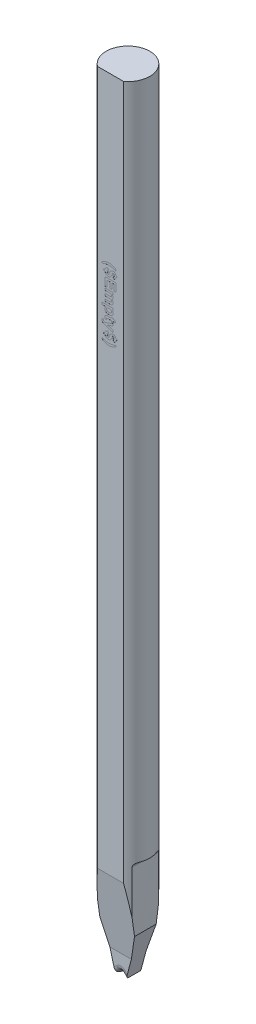
from build123d import *

# Parameters (mm, degrees)
SKETCH_TL_CUTTING_R       = 1.99771
TL_CUTTING_DEPTH          = 72.009
SKETCH_TDF_GRINDING_W     = 4.01542
SKETCH_TDF_GRINDING_H     = 4.01542
TDF_GRINDING_DEPTH        = 73.064400167
ENGRAVING_DEPTH           = 0.005
VW_VR_GRINDING_DEPTH      = 2.00771
VW_VR_GRINDING_DEPTH_BACK = 2.00771
ISA_GRINDING_DEPTH        = 2.00771
ISA_GRINDING_DEPTH_BACK   = 2.00771
PRE_FRX_BRX_DEPTH         = 2.00771
PRE_FRX_BRX_DEPTH_BACK    = 2.00771
SKETCH_PRE_FRX_BRX_W      = 1.33334
SKETCH_PRE_FRX_BRX_H      = 1.80086
FR_EDM_R                  = 0.50038
BR_EDM_R                  = 0.24892
FA_BA_GRINDING_DEPTH      = 2.00771
FA_BA_GRINDING_DEPTH_BACK = 2.00771


with BuildPart() as part:
    # sketch_TL_cutting → TL_cutting (new body)
    with BuildSketch(Plane(origin=(0, 0, 0), x_dir=(1, 0, 0), z_dir=(0, 1, 0))):
        Circle(SKETCH_TL_CUTTING_R)
    extrude(amount=TL_CUTTING_DEPTH)

    # sketch_TDF_grinding → TDF_grinding (cut, through all)
    with BuildSketch(Plane(origin=(0, 0, 0), x_dir=(1, 0, 0), z_dir=(0, 1, 0))):
        with Locations((0, -3.60918)):
            Rectangle(SKETCH_TDF_GRINDING_W, SKETCH_TDF_GRINDING_H)
    extrude(amount=TDF_GRINDING_DEPTH, mode=Mode.SUBTRACT)

    # sketch_engraving → engraving (cut)
    # profile 1 of 9: a face of its own
    with BuildSketch(Plane.XY.offset(1.60147)):
        with BuildLine():
            Line((-0.769230769, 56.611564103), (-0.769230769, 56.726948718))
            add(Edge.make_bspline(
                [(-0.769230769, 56.726948718), (-0.75654381, 56.735663826), (-0.731271202, 56.75302445), (-0.692407522, 56.777108744), (-0.653253405, 56.799807931), (-0.61390654, 56.821057444), (-0.574088198, 56.840594152), (-0.533834647, 56.85827299), (-0.493399806, 56.874882514), (-0.452559629, 56.889379278), (-0.411730957, 56.902372472), (-0.37117072, 56.913933672), (-0.330720232, 56.923167297), (-0.290776237, 56.931412038), (-0.251027852, 56.937272807), (-0.211754164, 56.941765375), (-0.172781576, 56.944468765), (-0.146905785, 56.944754889), (-0.134014423, 56.944897436)],
                knots=[0, 0, 0, 0, 1.083507766, 2.158363427, 3.217863588, 4.26952313, 5.306027247, 6.339424422, 7.364296331, 8.382863073, 9.389381803, 10.380601174, 11.351000725, 12.30983044, 13.25126181, 14.178453692, 15.092502614, 16, 16, 16, 16], degree=3))
            add(Edge.make_bspline(
                [(-0.134014423, 56.944897436), (-0.118183889, 56.944720886), (-0.086756823, 56.944370396), (-0.039956705, 56.941072127), (0.006211299, 56.935593151), (0.051774559, 56.928331702), (0.096653064, 56.918551161), (0.140935004, 56.90698945), (0.184649405, 56.893283306), (0.2131297, 56.882285182), (0.227363782, 56.876788462)],
                knots=[0, 0, 0, 0, 1.026825403, 2.038472649, 3.041589395, 4.042121555, 5.030199178, 6.019908545, 7.010375948, 8, 8, 8, 8], degree=3))
            add(Edge.make_bspline(
                [(0.227363782, 56.876788462), (0.251683724, 56.86662748), (0.300012726, 56.846435406), (0.369571494, 56.810574678), (0.43660795, 56.771337941), (0.478889333, 56.74173111), (0.5, 56.726948718)],
                knots=[0, 0, 0, 0, 1.013799707, 2.014640032, 3.00872983, 4, 4, 4, 4], degree=3))
            Line((0.5, 56.726948718), (0.5, 56.611564103))
            add(Edge.make_bspline(
                [(0.5, 56.611564103), (0.483671183, 56.618120598), (0.451734259, 56.630944202), (0.404403907, 56.648404634), (0.359131946, 56.664765299), (0.315658143, 56.679413628), (0.273946214, 56.69238068), (0.234213299, 56.70413527), (0.196217088, 56.713881677), (0.148045143, 56.725244778), (0.087918925, 56.736328711), (0.014547585, 56.745586625), (-0.060927268, 56.751701265), (-0.111967077, 56.752291015), (-0.137820513, 56.752589744)],
                knots=[0, 0, 0, 0, 0.962863393, 1.883228553, 2.76049045, 3.597092273, 4.393389301, 5.150807945, 5.864262675, 6.539665604, 7.859093728, 9.207470704, 10.585486956, 12, 12, 12, 12], degree=3))
            add(Edge.make_bspline(
                [(-0.137820513, 56.752589744), (-0.155988322, 56.752343487), (-0.192554908, 56.751847842), (-0.247746387, 56.748261408), (-0.303631191, 56.742771672), (-0.359778417, 56.734616456), (-0.415599441, 56.724983778), (-0.470281715, 56.713252997), (-0.523675907, 56.700229417), (-0.558467126, 56.689835667), (-0.575721154, 56.68468109)],
                knots=[0, 0, 0, 0, 0.980476084, 1.97341699, 2.983932057, 4.010380506, 5.034783484, 6.040583597, 7.02826557, 8, 8, 8, 8], degree=3))
            add(Edge.make_bspline(
                [(-0.575721154, 56.68468109), (-0.581680072, 56.682859776), (-0.594203733, 56.679031979), (-0.613643056, 56.671976075), (-0.635084462, 56.664505083), (-0.658352199, 56.655786341), (-0.683499135, 56.646272512), (-0.710430496, 56.635536673), (-0.739235975, 56.623981317), (-0.7590223, 56.615790194), (-0.769230769, 56.611564103)],
                knots=[0, 0, 0, 0, 0.722569934, 1.518601428, 2.397973139, 3.356076064, 4.400297102, 5.516290093, 6.718565658, 8, 8, 8, 8], degree=3))
        make_face()
    # profile 2 of 9: a face of its own
    with BuildSketch(Plane.XY.offset(1.60147)):
        with BuildLine():
            Line((-0.346153846, 56.226948718), (-0.063902244, 56.226948718))
            add(Edge.make_bspline(
                [(-0.063902244, 56.226948718), (-0.060691422, 56.237143266), (-0.054417647, 56.257062868), (-0.043102981, 56.285435864), (-0.03104034, 56.311894737), (-0.017255553, 56.335922913), (-0.002706808, 56.358195401), (0.013349437, 56.378160446), (0.030392388, 56.396185381), (0.048816212, 56.411900426), (0.068263793, 56.425644345), (0.088567069, 56.437911105), (0.110125164, 56.447723618), (0.132438861, 56.456389102), (0.155973296, 56.462652823), (0.180398952, 56.467325467), (0.205875491, 56.469883399), (0.223151848, 56.470317076), (0.231971154, 56.470538462)],
                knots=[0, 0, 0, 0, 1.233471439, 2.410137288, 3.52407584, 4.58730311, 5.604983541, 6.592165279, 7.540854934, 8.464761394, 9.382375568, 10.287963167, 11.198393515, 12.113251355, 13.048281916, 14.005296989, 14.981735836, 16, 16, 16, 16], degree=3))
            add(Edge.make_bspline(
                [(0.231971154, 56.470538462), (0.240862374, 56.470369834), (0.258371063, 56.47003777), (0.284035262, 56.466710465), (0.308630388, 56.461512705), (0.332214124, 56.454327878), (0.354666156, 56.444872426), (0.375999861, 56.433410852), (0.396225213, 56.419891645), (0.415061575, 56.404246572), (0.432812136, 56.387237259), (0.448139285, 56.36818408), (0.461933462, 56.348127842), (0.473588781, 56.326562978), (0.483166571, 56.303572929), (0.491049568, 56.279359162), (0.496663149, 56.253639945), (0.49887037, 56.235984548), (0.5, 56.226948718)],
                knots=[0, 0, 0, 0, 1.065419917, 2.098036635, 3.096580821, 4.076501369, 5.04880669, 6.012240184, 6.975806694, 7.959773282, 8.944748783, 9.917449457, 10.885494533, 11.859775015, 12.849941464, 13.867618658, 14.908671599, 16, 16, 16, 16], degree=3))
            Line((0.5, 56.226948718), (0.576923077, 56.226948718))
            Line((0.576923077, 56.226948718), (0.576923077, 56.124384615))
            Line((0.576923077, 56.124384615), (0.5, 56.124384615))
            add(Edge.make_bspline(
                [(0.5, 56.124384615), (0.498841424, 56.115486686), (0.496573389, 56.09806805), (0.49137632, 56.072741064), (0.484539762, 56.048860422), (0.476339583, 56.026349842), (0.466697028, 56.005143702), (0.455518194, 55.985361964), (0.442840864, 55.966933141), (0.428527318, 55.95018479), (0.413145824, 55.934584638), (0.39610941, 55.920827789), (0.378155721, 55.908112331), (0.358829355, 55.897061433), (0.338178987, 55.887674614), (0.316411919, 55.87941047), (0.293274546, 55.872799442), (0.27733531, 55.869600771), (0.269230769, 55.867974359)],
                knots=[0, 0, 0, 0, 1.151887312, 2.254940947, 3.31604567, 4.338626222, 5.328478017, 6.30366564, 7.252607131, 8.195603958, 9.129238937, 10.061258459, 11.003163313, 11.951756149, 12.914654824, 13.913120779, 14.938895277, 16, 16, 16, 16], degree=3))
            Line((0.269230769, 55.867974359), (0.243589744, 56.034641026))
            add(Edge.make_bspline(
                [(0.243589744, 56.034641026), (0.250446456, 56.036643558), (0.263771485, 56.040535192), (0.282535036, 56.048465441), (0.299671316, 56.057678859), (0.315110354, 56.068227628), (0.328747964, 56.080224188), (0.340615646, 56.09355588), (0.351026936, 56.108191319), (0.356312409, 56.118960751), (0.358974359, 56.124384615)],
                knots=[0, 0, 0, 0, 1.132612369, 2.201068414, 3.225051706, 4.215432487, 5.161289188, 6.099220658, 7.04270083, 8, 8, 8, 8], degree=3))
            Line((0.358974359, 56.124384615), (0.095552885, 56.124384615))
            add(Edge.make_bspline(
                [(0.095552885, 56.124384615), (0.091846888, 56.111134392), (0.084711092, 56.085621445), (0.072793936, 56.049230821), (0.059721416, 56.016296736), (0.046029912, 55.986577051), (0.031359337, 55.960199095), (0.016057305, 55.936950063), (-0.000406851, 55.917264806), (-0.017692985, 55.90057685), (-0.036309981, 55.887032312), (-0.055531671, 55.874731893), (-0.076319964, 55.864821076), (-0.098285192, 55.856514134), (-0.121510852, 55.850207549), (-0.145938277, 55.845497559), (-0.171622588, 55.842996815), (-0.189164574, 55.842557523), (-0.198116987, 55.842333333)],
                knots=[0, 0, 0, 0, 1.47567488, 2.841372022, 4.104837161, 5.274356171, 6.348422789, 7.339634063, 8.254806618, 9.095728451, 9.909336987, 10.720135121, 11.540149133, 12.374211184, 13.236039526, 14.118162803, 15.039619326, 16, 16, 16, 16], degree=3))
            add(Edge.make_bspline(
                [(-0.198116987, 55.842333333), (-0.208142, 55.842575379), (-0.227850116, 55.843051216), (-0.256821167, 55.846471811), (-0.284551423, 55.852320659), (-0.311143037, 55.860302461), (-0.336478096, 55.870703856), (-0.360449465, 55.883721867), (-0.383339011, 55.898751156), (-0.405018236, 55.915957227), (-0.425053345, 55.935437905), (-0.443316442, 55.956889482), (-0.459578741, 55.980293772), (-0.474036034, 56.005432354), (-0.486703174, 56.032431862), (-0.497491454, 56.061298177), (-0.506369109, 56.092117722), (-0.510637243, 56.113464927), (-0.512820513, 56.124384615)],
                knots=[0, 0, 0, 0, 1.03830894, 2.041205585, 3.016534218, 3.970513834, 4.913295289, 5.847846025, 6.791667113, 7.746548932, 8.710133323, 9.681653264, 10.66021374, 11.657945465, 12.682082278, 13.745789509, 14.84690868, 16, 16, 16, 16], degree=3))
            Line((-0.512820513, 56.124384615), (-0.641025641, 56.124384615))
            Line((-0.641025641, 56.124384615), (-0.641025641, 56.226948718))
            Line((-0.641025641, 56.226948718), (-0.512820513, 56.226948718))
            add(Edge.make_bspline(
                [(-0.512820513, 56.226948718), (-0.511365569, 56.235993376), (-0.508497729, 56.253821301), (-0.501708114, 56.279680106), (-0.493672179, 56.304444222), (-0.483362821, 56.327734513), (-0.471282985, 56.349710338), (-0.457442831, 56.370330001), (-0.441914521, 56.389778959), (-0.424444795, 56.407782199), (-0.405185733, 56.424467381), (-0.384010208, 56.4395823), (-0.360904849, 56.452986013), (-0.335919458, 56.464741317), (-0.309230571, 56.475320078), (-0.280464835, 56.483703551), (-0.249946988, 56.491100501), (-0.228795072, 56.494457879), (-0.217948718, 56.496179487)],
                knots=[0, 0, 0, 0, 1.014565868, 1.999810643, 2.959153021, 3.896762473, 4.817401281, 5.734733625, 6.645326844, 7.571538865, 8.510548692, 9.465314575, 10.450114695, 11.466190414, 12.522838407, 13.627737783, 14.783543095, 16, 16, 16, 16], degree=3))
            Line((-0.217948718, 56.496179487), (-0.192307692, 56.329512821))
            add(Edge.make_bspline(
                [(-0.192307692, 56.329512821), (-0.201304383, 56.327560775), (-0.218871734, 56.323749123), (-0.243936875, 56.315017324), (-0.267070938, 56.304026951), (-0.287973212, 56.290797737), (-0.306574231, 56.276291657), (-0.322506138, 56.260740348), (-0.336055086, 56.244580368), (-0.342841228, 56.232732292), (-0.346153846, 56.226948718)],
                knots=[0, 0, 0, 0, 1.156277083, 2.257799727, 3.327693098, 4.368586128, 5.360870913, 6.286760294, 7.163691387, 8, 8, 8, 8], degree=3))
        make_face()
        with BuildLine():
            add(Edge.make_bspline(
                [(0.358974359, 56.226948718), (0.356717333, 56.232992086), (0.352323078, 56.244758059), (0.342207363, 56.260507034), (0.329671684, 56.273923048), (0.314627801, 56.284702628), (0.298154817, 56.293142912), (0.280699719, 56.299552483), (0.262303768, 56.303185993), (0.249748228, 56.303641235), (0.243389423, 56.303871795)],
                knots=[0, 0, 0, 0, 1.038261919, 2.021415961, 2.996868165, 3.983674221, 4.990617688, 5.975363788, 6.97461459, 8, 8, 8, 8], degree=3))
            add(Edge.make_bspline(
                [(0.243389423, 56.303871795), (0.23756032, 56.303721402), (0.225998475, 56.303423102), (0.209074665, 56.29974233), (0.192634157, 56.29441819), (0.177010257, 56.286573685), (0.16226258, 56.276278866), (0.149112783, 56.262726829), (0.137430451, 56.24612493), (0.131236645, 56.233523802), (0.128004808, 56.226948718)],
                knots=[0, 0, 0, 0, 0.946787839, 1.877924175, 2.805567745, 3.753041052, 4.711661487, 5.718097864, 6.809336945, 8, 8, 8, 8], degree=3))
            Line((0.128004808, 56.226948718), (0.358974359, 56.226948718))
        make_face(mode=Mode.SUBTRACT)
        with BuildLine():
            add(Edge.make_bspline(
                [(-0.346153846, 56.124384615), (-0.345705345, 56.116185175), (-0.34483103, 56.100201084), (-0.337601638, 56.077493624), (-0.325657788, 56.057310262), (-0.309263795, 56.040179958), (-0.289891882, 56.026342959), (-0.268342869, 56.016345675), (-0.24520997, 56.010077578), (-0.229139944, 56.009363677), (-0.220953526, 56.009)],
                knots=[0, 0, 0, 0, 1.03495557, 2.017555319, 2.978963058, 3.976357979, 4.993109917, 5.971347703, 6.966560647, 8, 8, 8, 8], degree=3))
            add(Edge.make_bspline(
                [(-0.220953526, 56.009), (-0.213643973, 56.009272343), (-0.199375663, 56.00980396), (-0.178751062, 56.015029744), (-0.159765904, 56.023484931), (-0.142238273, 56.03538561), (-0.126537208, 56.051348938), (-0.113258624, 56.071844849), (-0.101443075, 56.096373029), (-0.09589405, 56.114671881), (-0.092948718, 56.124384615)],
                knots=[0, 0, 0, 0, 0.934982296, 1.825093612, 2.705865091, 3.586179448, 4.523819282, 5.553563867, 6.701471314, 8, 8, 8, 8], degree=3))
            Line((-0.092948718, 56.124384615), (-0.346153846, 56.124384615))
        make_face(mode=Mode.SUBTRACT)
    # profile 3 of 9: a face of its own
    with BuildSketch(Plane.XY.offset(1.60147)):
        Polygon((-0.5, 55.675666667), (0.5, 55.675666667), (0.5, 54.932076923), (0.333333333, 54.932076923), (0.333333333, 55.483358974), (0.115384615, 55.483358974), (0.115384615, 54.970538462), (-0.051282051, 54.970538462), (-0.051282051, 55.483358974), (-0.333333333, 55.483358974), (-0.333333333, 54.91925641), (-0.5, 54.91925641), align=None)
    # profile 4 of 9: a face of its own
    with BuildSketch(Plane.XY.offset(1.60147)):
        with BuildLine():
            Line((0.230769231, 54.778230769), (0.230769231, 54.585923077))
            Line((0.230769231, 54.585923077), (0.1328125, 54.585923077))
            add(Edge.make_bspline(
                [(0.1328125, 54.585923077), (0.141664699, 54.578359049), (0.158931351, 54.563605038), (0.181382685, 54.538923789), (0.200586186, 54.513416739), (0.21644089, 54.486832809), (0.228531159, 54.458934117), (0.237134296, 54.429946875), (0.242539521, 54.399891949), (0.243237377, 54.379481895), (0.243589744, 54.369176282)],
                knots=[0, 0, 0, 0, 1.107940857, 2.161093632, 3.169644562, 4.144639019, 5.101548547, 6.057210626, 7.019030711, 8, 8, 8, 8], degree=3))
            add(Edge.make_bspline(
                [(0.243589744, 54.369176282), (0.243215794, 54.358410033), (0.242486901, 54.337424744), (0.237632212, 54.306967189), (0.228624904, 54.278890488), (0.216596826, 54.25293503), (0.200997643, 54.229186923), (0.181697421, 54.207803483), (0.1589088, 54.188570942), (0.141647297, 54.178047815), (0.1328125, 54.172661859)],
                knots=[0, 0, 0, 0, 1.087442074, 2.119613481, 3.102840357, 4.056171906, 5.000733146, 5.960649063, 6.95621775, 8, 8, 8, 8], degree=3))
            add(Edge.make_bspline(
                [(0.1328125, 54.172661859), (0.141648331, 54.164741809), (0.15890459, 54.149274061), (0.18160607, 54.123912536), (0.200837622, 54.097588586), (0.216342266, 54.070185607), (0.228440547, 54.041886572), (0.237463475, 54.012736515), (0.242455792, 53.982395313), (0.243209151, 53.961874823), (0.243589744, 53.951508013)],
                knots=[0, 0, 0, 0, 1.113355786, 2.174368662, 3.188819075, 4.168565139, 5.12342631, 6.073356391, 7.026672896, 8, 8, 8, 8], degree=3))
            add(Edge.make_bspline(
                [(0.243589744, 53.951508013), (0.243253707, 53.938725949), (0.242603687, 53.914000698), (0.236233833, 53.878451934), (0.226092646, 53.845846208), (0.211825029, 53.816371427), (0.193628332, 53.79007465), (0.171312748, 53.767536921), (0.145297956, 53.748199279), (0.125650654, 53.738783721), (0.115584936, 53.733959936)],
                knots=[0, 0, 0, 0, 1.140905914, 2.206935121, 3.214358517, 4.182792527, 5.121068659, 6.057503675, 7.004819049, 8, 8, 8, 8], degree=3))
            add(Edge.make_bspline(
                [(0.115584936, 53.733959936), (0.1114006, 53.732358143), (0.102614163, 53.728994633), (0.088193677, 53.7250406), (0.07205936, 53.721717836), (0.05407705, 53.718900231), (0.034354022, 53.716783997), (0.012779717, 53.715109993), (-0.010546601, 53.714459858), (-0.026709385, 53.714241149), (-0.03505609, 53.714128205)],
                knots=[0, 0, 0, 0, 0.70348757, 1.477211565, 2.345356006, 3.290383569, 4.335215205, 5.460703428, 6.68866909, 8, 8, 8, 8], degree=3))
            Line((-0.03505609, 53.714128205), (-0.5, 53.714128205))
            Line((-0.5, 53.714128205), (-0.5, 53.906435897))
            Line((-0.5, 53.906435897), (-0.080128205, 53.906435897))
            add(Edge.make_bspline(
                [(-0.080128205, 53.906435897), (-0.07144761, 53.906547935), (-0.054817384, 53.906762576), (-0.031090468, 53.907406731), (-0.009777274, 53.909044643), (0.009076857, 53.911186366), (0.025551617, 53.91391905), (0.039613136, 53.917295096), (0.051411557, 53.921089266), (0.058064109, 53.924645803), (0.061097756, 53.926267628)],
                knots=[0, 0, 0, 0, 1.448583407, 2.775186282, 3.959557885, 5.014017743, 5.940851432, 6.743435621, 7.42699079, 8, 8, 8, 8], degree=3))
            add(Edge.make_bspline(
                [(0.061097756, 53.926267628), (0.0644449, 53.928508242), (0.071015994, 53.932907002), (0.079428524, 53.94104351), (0.086594396, 53.949987573), (0.092366124, 53.959872082), (0.097066603, 53.970530677), (0.100204228, 53.982148841), (0.10230955, 53.994633517), (0.102477414, 54.003314837), (0.102564103, 54.007798077)],
                knots=[0, 0, 0, 0, 1.007330723, 1.977586358, 2.91811154, 3.870610884, 4.837109745, 5.827490497, 6.87806446, 8, 8, 8, 8], degree=3))
            add(Edge.make_bspline(
                [(0.102564103, 54.007798077), (0.102240034, 54.01443365), (0.101593875, 54.027664313), (0.09685111, 54.047122239), (0.088810593, 54.065848966), (0.077873982, 54.083699946), (0.064089543, 54.100338814), (0.046951113, 54.114414723), (0.027058253, 54.126184107), (0.008201325, 54.133566057), (-0.008714124, 54.138275058), (-0.023370098, 54.141428886), (-0.039736185, 54.144230026), (-0.057919723, 54.146426211), (-0.07777632, 54.14791842), (-0.09941442, 54.149127695), (-0.122723067, 54.149973668), (-0.138888099, 54.150007942), (-0.147235577, 54.150025641)],
                knots=[0, 0, 0, 0, 0.980909897, 1.955835539, 2.942693402, 3.98436442, 5.042755257, 6.12263035, 7.247279534, 8.448501813, 9.105087946, 9.843148781, 10.66469806, 11.560151265, 12.550905382, 13.609296218, 14.765461946, 16, 16, 16, 16], degree=3))
            Line((-0.147235577, 54.150025641), (-0.5, 54.150025641))
            Line((-0.5, 54.150025641), (-0.5, 54.342333333))
            Line((-0.5, 54.342333333), (-0.097355769, 54.342333333))
            add(Edge.make_bspline(
                [(-0.097355769, 54.342333333), (-0.088808683, 54.342387673), (-0.072514885, 54.342491264), (-0.049272866, 54.342832415), (-0.028431625, 54.343598963), (-0.010001412, 54.344816338), (0.006094573, 54.346219335), (0.019817647, 54.347693711), (0.031211059, 54.3496468), (0.042972639, 54.352762901), (0.055281064, 54.357674574), (0.068015353, 54.364905367), (0.078952496, 54.37337508), (0.087734398, 54.383592499), (0.094431133, 54.39552783), (0.099289836, 54.409190268), (0.101996826, 54.424759663), (0.102369061, 54.435739069), (0.102564103, 54.441491987)],
                knots=[0, 0, 0, 0, 1.59941463, 3.049055322, 4.349500855, 5.501487129, 6.504910079, 7.372843676, 8.083634967, 8.665560774, 9.647038445, 10.55368294, 11.398647399, 12.222657519, 13.056461931, 13.945719492, 14.92361148, 16, 16, 16, 16], degree=3))
            add(Edge.make_bspline(
                [(0.102564103, 54.441491987), (0.102234348, 54.448658367), (0.101586917, 54.462728621), (0.097099356, 54.483322194), (0.089385598, 54.502697199), (0.078745529, 54.520760574), (0.065308531, 54.537164364), (0.048811546, 54.551063128), (0.02977557, 54.562600394), (0.011740073, 54.569890429), (-0.004479026, 54.57462018), (-0.018770373, 54.57751101), (-0.034874654, 54.580111233), (-0.052844538, 54.58232052), (-0.072766981, 54.583839446), (-0.094540599, 54.585014918), (-0.118182385, 54.585875318), (-0.134547779, 54.585906775), (-0.143028846, 54.585923077)],
                knots=[0, 0, 0, 0, 1.061105177, 2.08334182, 3.104381884, 4.137278018, 5.176827868, 6.229094397, 7.316239487, 8.460364206, 9.09881589, 9.816452537, 10.617971519, 11.514628853, 12.496857794, 13.576419947, 14.74402393, 16, 16, 16, 16], degree=3))
            Line((-0.143028846, 54.585923077), (-0.5, 54.585923077))
            Line((-0.5, 54.585923077), (-0.5, 54.778230769))
            Line((-0.5, 54.778230769), (0.230769231, 54.778230769))
        make_face()
    # profile 5 of 9: a face of its own
    with BuildSketch(Plane.XY.offset(1.60147)):
        with BuildLine():
            Line((0.230769231, 53.521820513), (0.230769231, 53.329512821))
            Line((0.230769231, 53.329512821), (0.125400641, 53.329512821))
            add(Edge.make_bspline(
                [(0.125400641, 53.329512821), (0.134110558, 53.323789731), (0.151482958, 53.312374718), (0.174623276, 53.291319889), (0.194727471, 53.267179744), (0.21216262, 53.240640955), (0.226252501, 53.211806915), (0.236247247, 53.181133514), (0.242498657, 53.148943396), (0.243222023, 53.126950728), (0.243589744, 53.115770833)],
                knots=[0, 0, 0, 0, 0.978547196, 1.95176541, 2.927409496, 3.924956672, 4.929940552, 5.934297003, 6.949907262, 8, 8, 8, 8], degree=3))
            add(Edge.make_bspline(
                [(0.243589744, 53.115770833), (0.243275199, 53.106003359), (0.242653327, 53.086692556), (0.237904657, 53.058336182), (0.230300531, 53.031019066), (0.219424348, 53.00483804), (0.205256392, 52.979900966), (0.188112758, 52.956138662), (0.167850875, 52.933577666), (0.144791975, 52.912281795), (0.118886648, 52.892784547), (0.090438984, 52.875746955), (0.059420431, 52.861512172), (0.02614289, 52.849614093), (-0.00973483, 52.840790018), (-0.047865347, 52.834089032), (-0.088468702, 52.830383122), (-0.116312431, 52.82980808), (-0.130608974, 52.829512821)],
                knots=[0, 0, 0, 0, 0.889183518, 1.757962001, 2.610823862, 3.466866804, 4.332788647, 5.217155532, 6.130223362, 7.089913047, 8.071415563, 9.077827182, 10.103546864, 11.174887114, 12.291391641, 13.464112916, 14.69793237, 16, 16, 16, 16], degree=3))
            add(Edge.make_bspline(
                [(-0.130608974, 52.829512821), (-0.145309675, 52.829777446), (-0.173899782, 52.830292094), (-0.215458383, 52.834402127), (-0.254585771, 52.840776506), (-0.291083626, 52.85058219), (-0.325347568, 52.862394954), (-0.356921697, 52.877327394), (-0.386073852, 52.894801106), (-0.412336985, 52.915059239), (-0.435948519, 52.936992733), (-0.456547424, 52.960307103), (-0.473866574, 52.984832979), (-0.488041441, 53.010500814), (-0.499108447, 53.03731691), (-0.507216556, 53.065229904), (-0.511869709, 53.094380749), (-0.512500462, 53.114152095), (-0.512820513, 53.124184295)],
                knots=[0, 0, 0, 0, 1.306276956, 2.54046374, 3.708317787, 4.825351227, 5.895229917, 6.925275359, 7.923721025, 8.910100439, 9.867470588, 10.784172372, 11.670002506, 12.530604141, 13.384735846, 14.243124713, 15.108541968, 16, 16, 16, 16], degree=3))
            add(Edge.make_bspline(
                [(-0.512820513, 53.124184295), (-0.512609167, 53.133690186), (-0.512194245, 53.152352468), (-0.507198627, 53.179557904), (-0.500287281, 53.205588151), (-0.489449809, 53.230441328), (-0.475076841, 53.254817244), (-0.456848814, 53.279593251), (-0.434276455, 53.304830916), (-0.417064851, 53.321030662), (-0.408052885, 53.329512821)],
                knots=[0, 0, 0, 0, 0.955822701, 1.876503125, 2.776905967, 3.662325514, 4.596312032, 5.620965962, 6.754341905, 8, 8, 8, 8], degree=3))
            Line((-0.408052885, 53.329512821), (-0.769230769, 53.329512821))
            Line((-0.769230769, 53.329512821), (-0.769230769, 53.521820513))
            Line((-0.769230769, 53.521820513), (0.230769231, 53.521820513))
        make_face()
        with BuildLine():
            add(Edge.make_bspline(
                [(-0.122195513, 53.329512821), (-0.132481435, 53.329330938), (-0.152405274, 53.328978631), (-0.181244648, 53.327077339), (-0.208037309, 53.323546885), (-0.232684253, 53.318235747), (-0.255441334, 53.312050174), (-0.275988928, 53.303930804), (-0.294539024, 53.294622167), (-0.310824186, 53.283698167), (-0.325130191, 53.271818833), (-0.337524496, 53.259247515), (-0.348144327, 53.246075436), (-0.356821345, 53.23224956), (-0.363446941, 53.217669312), (-0.368372821, 53.202507368), (-0.371163803, 53.186653237), (-0.371583715, 53.175877184), (-0.371794872, 53.170458333)],
                knots=[0, 0, 0, 0, 1.493314022, 2.892550594, 4.193549699, 5.412205958, 6.550654332, 7.612709232, 8.614154521, 9.557822924, 10.452682187, 11.309508678, 12.116407821, 12.904513946, 13.672267114, 14.435601522, 15.213325928, 16, 16, 16, 16], degree=3))
            add(Edge.make_bspline(
                [(-0.371794872, 53.170458333), (-0.371659076, 53.165238996), (-0.371390934, 53.154932918), (-0.368717534, 53.139850329), (-0.36428733, 53.1254401), (-0.35796517, 53.111782234), (-0.350180339, 53.098647389), (-0.340400371, 53.086335676), (-0.328879204, 53.074787269), (-0.315890023, 53.063521873), (-0.300495775, 53.053808804), (-0.283066961, 53.045116707), (-0.26342759, 53.037702345), (-0.241425455, 53.032059812), (-0.21727146, 53.027453704), (-0.190916328, 53.02410908), (-0.162291664, 53.022084026), (-0.142498204, 53.021910628), (-0.132211538, 53.021820513)],
                knots=[0, 0, 0, 0, 0.791436533, 1.562766886, 2.315979036, 3.073269983, 3.841398674, 4.627954771, 5.451998839, 6.314818792, 7.231140921, 8.205467689, 9.266952699, 10.409907015, 11.648037837, 12.996681567, 14.439174734, 16, 16, 16, 16], degree=3))
            add(Edge.make_bspline(
                [(-0.132211538, 53.021820513), (-0.122590159, 53.021885744), (-0.103987384, 53.022011868), (-0.077055352, 53.024396462), (-0.051997139, 53.027603604), (-0.028873936, 53.032518131), (-0.007518455, 53.038306551), (0.01172948, 53.046020618), (0.029199081, 53.054792491), (0.044606747, 53.065096056), (0.058319539, 53.076225976), (0.069887203, 53.088411635), (0.080128065, 53.10083484), (0.08840061, 53.11408001), (0.094621072, 53.128151434), (0.099305551, 53.142696751), (0.101912651, 53.158013515), (0.102344136, 53.168379172), (0.102564103, 53.173663462)],
                knots=[0, 0, 0, 0, 1.476459806, 2.854710082, 4.147877, 5.352136794, 6.481419541, 7.539804139, 8.530071065, 9.476830027, 10.379846701, 11.23529603, 12.051777807, 12.848258948, 13.623682229, 14.408266492, 15.188553102, 16, 16, 16, 16], degree=3))
            add(Edge.make_bspline(
                [(0.102564103, 53.173663462), (0.102455308, 53.179153683), (0.102241498, 53.189943463), (0.099201363, 53.205705699), (0.094853437, 53.220854844), (0.088686029, 53.235317083), (0.080452533, 53.248825762), (0.070807323, 53.261847745), (0.059117992, 53.273947129), (0.045859614, 53.285459774), (0.030812699, 53.295916203), (0.01390315, 53.304896172), (-0.00466452, 53.312440447), (-0.024767533, 53.318971117), (-0.046730612, 53.323669687), (-0.070369893, 53.326944967), (-0.095705859, 53.329315572), (-0.113175154, 53.329445653), (-0.122195513, 53.329512821)],
                knots=[0, 0, 0, 0, 0.85812159, 1.686442648, 2.503408574, 3.322778131, 4.138405645, 4.97460315, 5.854412976, 6.765937777, 7.719865152, 8.715925653, 9.756353289, 10.85381274, 12.020422519, 13.266547949, 14.588568337, 16, 16, 16, 16], degree=3))
        make_face(mode=Mode.SUBTRACT)
    # profile 6 of 9: a face of its own
    with BuildSketch(Plane.XY.offset(1.60147)):
        with BuildLine():
            Line((0.230769231, 52.329512821), (0.08974359, 52.329512821))
            Line((0.08974359, 52.329512821), (0.08974359, 52.470538462))
            Line((0.08974359, 52.470538462), (-0.224358974, 52.470538462))
            add(Edge.make_bspline(
                [(-0.224358974, 52.470538462), (-0.231904339, 52.47055171), (-0.246127351, 52.470576684), (-0.266228543, 52.470412391), (-0.283853768, 52.469932133), (-0.299018236, 52.469649783), (-0.311701045, 52.46897022), (-0.321861303, 52.468462927), (-0.329566697, 52.467740323), (-0.338907815, 52.466012609), (-0.35057578, 52.46098511), (-0.360389431, 52.451317637), (-0.366182432, 52.44179528), (-0.369474906, 52.433766405), (-0.371514578, 52.424967167), (-0.371700117, 52.418800144), (-0.371794872, 52.415650641)],
                knots=[0, 0, 0, 0, 1.773599637, 3.343235314, 4.724802322, 5.918078765, 6.908020279, 7.709878159, 8.309605123, 8.725167438, 9.94114383, 11.228754835, 11.890951744, 12.552590386, 13.260806876, 14, 14, 14, 14], degree=3))
            add(Edge.make_bspline(
                [(-0.371794872, 52.415650641), (-0.371507964, 52.410495649), (-0.37087716, 52.399161728), (-0.367095421, 52.380687003), (-0.361305779, 52.35922894), (-0.356131124, 52.344040802), (-0.353365385, 52.335923077)],
                knots=[0, 0, 0, 0, 0.75345353, 1.656565626, 2.747486109, 4, 4, 4, 4], degree=3))
            Line((-0.353365385, 52.335923077), (-0.487379808, 52.316692308))
            add(Edge.make_bspline(
                [(-0.487379808, 52.316692308), (-0.491390152, 52.328369641), (-0.499569528, 52.352186373), (-0.506906498, 52.3900411), (-0.512003384, 52.42993354), (-0.512543433, 52.457299316), (-0.512820513, 52.471339744)],
                knots=[0, 0, 0, 0, 0.939563481, 1.916305015, 2.930928536, 4, 4, 4, 4], degree=3))
            add(Edge.make_bspline(
                [(-0.512820513, 52.471339744), (-0.512564303, 52.479962381), (-0.512063975, 52.49680071), (-0.50889268, 52.521457549), (-0.50326966, 52.544746429), (-0.495519476, 52.566499989), (-0.485995694, 52.586145599), (-0.475305475, 52.603448436), (-0.462868601, 52.617641671), (-0.449141562, 52.629497462), (-0.433202705, 52.638848766), (-0.415065056, 52.646272715), (-0.394648734, 52.652652966), (-0.380046946, 52.655266675), (-0.372395833, 52.656636218)],
                knots=[0, 0, 0, 0, 1.203015215, 2.349253984, 3.460901624, 4.539344044, 5.564274864, 6.502382232, 7.367332183, 8.186789841, 9.022345106, 9.932420497, 10.916620053, 12, 12, 12, 12], degree=3))
            add(Edge.make_bspline(
                [(-0.372395833, 52.656636218), (-0.369192653, 52.657116428), (-0.362066116, 52.658184813), (-0.35025766, 52.659634383), (-0.336212257, 52.660528825), (-0.319980191, 52.661261789), (-0.301558032, 52.662201997), (-0.280981809, 52.662400781), (-0.258215711, 52.66297611), (-0.242321525, 52.662890903), (-0.233974359, 52.662846154)],
                knots=[0, 0, 0, 0, 0.560521704, 1.24706641, 2.057998689, 2.995119087, 4.059211621, 5.249632546, 6.555586685, 8, 8, 8, 8], degree=3))
            Line((-0.233974359, 52.662846154), (0.08974359, 52.662846154))
            Line((0.08974359, 52.662846154), (0.08974359, 52.752589744))
            Line((0.08974359, 52.752589744), (0.230769231, 52.752589744))
            Line((0.230769231, 52.752589744), (0.230769231, 52.662846154))
            Line((0.230769231, 52.662846154), (0.371794872, 52.662846154))
            Line((0.371794872, 52.662846154), (0.487179487, 52.470538462))
            Line((0.487179487, 52.470538462), (0.230769231, 52.470538462))
            Line((0.230769231, 52.470538462), (0.230769231, 52.329512821))
        make_face()
    # profile 7 of 9: a face of its own
    with BuildSketch(Plane.XY.offset(1.60147)):
        with BuildLine():
            Line((0.230769231, 52.303871795), (0.230769231, 52.111564103))
            Line((0.230769231, 52.111564103), (-0.286658654, 51.951307692))
            Line((-0.286658654, 51.951307692), (0.230769231, 51.791051282))
            Line((0.230769231, 51.791051282), (0.230769231, 51.59874359))
            Line((0.230769231, 51.59874359), (-0.466145833, 51.841732372))
            Line((-0.466145833, 51.841732372), (-0.598157051, 51.88780609))
            add(Edge.make_bspline(
                [(-0.598157051, 51.88780609), (-0.607606652, 51.89159762), (-0.625376306, 51.898727464), (-0.650028536, 51.910049297), (-0.671175741, 51.920862611), (-0.689167457, 51.931709184), (-0.704516652, 51.942913706), (-0.717943024, 51.954827994), (-0.730162212, 51.967284886), (-0.740813451, 51.980793571), (-0.750254429, 51.995532496), (-0.758328481, 52.011776596), (-0.76563939, 52.029473804), (-0.771559687, 52.048799905), (-0.776455479, 52.06952306), (-0.779384556, 52.091675696), (-0.781869716, 52.114981275), (-0.781989673, 52.130987518), (-0.782051282, 52.139208333)],
                knots=[0, 0, 0, 0, 1.442318569, 2.712231111, 3.841952651, 4.805677934, 5.685519496, 6.530069912, 7.346275571, 8.154437428, 8.962710014, 9.821550927, 10.7210084, 11.672490954, 12.682200373, 13.733763549, 14.836059795, 16, 16, 16, 16], degree=3))
            add(Edge.make_bspline(
                [(-0.782051282, 52.139208333), (-0.7816451, 52.156217724), (-0.780837731, 52.190027353), (-0.77455582, 52.223257127), (-0.771434295, 52.239769231)],
                knots=[0, 0, 0, 0, 1.006186215, 2, 2, 2, 2], degree=3))
            Line((-0.771434295, 52.239769231), (-0.632011218, 52.252589744))
            add(Edge.make_bspline(
                [(-0.632011218, 52.252589744), (-0.633415338, 52.245992157), (-0.636126927, 52.233251116), (-0.638960851, 52.214460996), (-0.640597369, 52.196662949), (-0.640885825, 52.185084749), (-0.641025641, 52.179472756)],
                knots=[0, 0, 0, 0, 1.096454798, 2.117437249, 3.087515614, 4, 4, 4, 4], degree=3))
            add(Edge.make_bspline(
                [(-0.641025641, 52.179472756), (-0.64091732, 52.174592773), (-0.640708773, 52.165197485), (-0.638908081, 52.151550373), (-0.635715822, 52.138918389), (-0.631252096, 52.127272811), (-0.625903073, 52.116443406), (-0.618924188, 52.106731769), (-0.610797334, 52.097950602), (-0.597999124, 52.087623602), (-0.579899103, 52.076234316), (-0.555710912, 52.064504301), (-0.528917644, 52.054174693), (-0.509869412, 52.048960982), (-0.5, 52.046259615)],
                knots=[0, 0, 0, 0, 0.826282398, 1.5908173, 2.325927711, 3.027474672, 3.700169566, 4.365407898, 5.04557163, 5.720354759, 7.144619778, 8.656909909, 10.267853154, 12, 12, 12, 12], degree=3))
            Line((-0.5, 52.046259615), (0.230769231, 52.303871795))
        make_face()
    # profile 8 of 9: a face of its own
    with BuildSketch(Plane.XY.offset(1.60147)):
        with BuildLine():
            Line((-0.346153846, 51.226948718), (-0.063902244, 51.226948718))
            add(Edge.make_bspline(
                [(-0.063902244, 51.226948718), (-0.060691422, 51.237143266), (-0.054417647, 51.257062868), (-0.043102981, 51.285435864), (-0.03104034, 51.311894737), (-0.017255553, 51.335922913), (-0.002706808, 51.358195401), (0.013349437, 51.378160446), (0.030392388, 51.396185381), (0.048816212, 51.411900426), (0.068263793, 51.425644345), (0.088567069, 51.437911105), (0.110125164, 51.447723618), (0.132438861, 51.456389102), (0.155973296, 51.462652823), (0.180398952, 51.467325467), (0.205875491, 51.469883399), (0.223151848, 51.470317076), (0.231971154, 51.470538462)],
                knots=[0, 0, 0, 0, 1.233471439, 2.410137288, 3.52407584, 4.58730311, 5.604983541, 6.592165279, 7.540854934, 8.464761394, 9.382375568, 10.287963167, 11.198393515, 12.113251355, 13.048281916, 14.005296989, 14.981735836, 16, 16, 16, 16], degree=3))
            add(Edge.make_bspline(
                [(0.231971154, 51.470538462), (0.240862374, 51.470369834), (0.258371063, 51.47003777), (0.284035262, 51.466710465), (0.308630388, 51.461512705), (0.332214124, 51.454327878), (0.354666156, 51.444872426), (0.375999861, 51.433410852), (0.396225213, 51.419891645), (0.415061575, 51.404246572), (0.432812136, 51.387237259), (0.448139285, 51.36818408), (0.461933462, 51.348127842), (0.473588781, 51.326562978), (0.483166571, 51.303572929), (0.491049568, 51.279359162), (0.496663149, 51.253639945), (0.49887037, 51.235984548), (0.5, 51.226948718)],
                knots=[0, 0, 0, 0, 1.065419917, 2.098036635, 3.096580821, 4.076501369, 5.04880669, 6.012240184, 6.975806694, 7.959773282, 8.944748783, 9.917449457, 10.885494533, 11.859775015, 12.849941464, 13.867618658, 14.908671599, 16, 16, 16, 16], degree=3))
            Line((0.5, 51.226948718), (0.576923077, 51.226948718))
            Line((0.576923077, 51.226948718), (0.576923077, 51.124384615))
            Line((0.576923077, 51.124384615), (0.5, 51.124384615))
            add(Edge.make_bspline(
                [(0.5, 51.124384615), (0.498841424, 51.115486686), (0.496573389, 51.09806805), (0.49137632, 51.072741064), (0.484539762, 51.048860422), (0.476339583, 51.026349842), (0.466697028, 51.005143702), (0.455518194, 50.985361964), (0.442840864, 50.966933141), (0.428527318, 50.95018479), (0.413145824, 50.934584638), (0.39610941, 50.920827789), (0.378155721, 50.908112331), (0.358829355, 50.897061433), (0.338178987, 50.887674614), (0.316411919, 50.87941047), (0.293274546, 50.872799442), (0.27733531, 50.869600771), (0.269230769, 50.867974359)],
                knots=[0, 0, 0, 0, 1.151887312, 2.254940947, 3.31604567, 4.338626222, 5.328478017, 6.30366564, 7.252607131, 8.195603958, 9.129238937, 10.061258459, 11.003163313, 11.951756149, 12.914654824, 13.913120779, 14.938895277, 16, 16, 16, 16], degree=3))
            Line((0.269230769, 50.867974359), (0.243589744, 51.034641026))
            add(Edge.make_bspline(
                [(0.243589744, 51.034641026), (0.250446456, 51.036643558), (0.263771485, 51.040535192), (0.282535036, 51.048465441), (0.299671316, 51.057678859), (0.315110354, 51.068227628), (0.328747964, 51.080224188), (0.340615646, 51.09355588), (0.351026936, 51.108191319), (0.356312409, 51.118960751), (0.358974359, 51.124384615)],
                knots=[0, 0, 0, 0, 1.132612369, 2.201068414, 3.225051706, 4.215432487, 5.161289188, 6.099220658, 7.04270083, 8, 8, 8, 8], degree=3))
            Line((0.358974359, 51.124384615), (0.095552885, 51.124384615))
            add(Edge.make_bspline(
                [(0.095552885, 51.124384615), (0.091846888, 51.111134392), (0.084711092, 51.085621445), (0.072793936, 51.049230821), (0.059721416, 51.016296736), (0.046029912, 50.986577051), (0.031359337, 50.960199095), (0.016057305, 50.936950063), (-0.000406851, 50.917264806), (-0.017692985, 50.90057685), (-0.036309981, 50.887032312), (-0.055531671, 50.874731893), (-0.076319964, 50.864821076), (-0.098285192, 50.856514134), (-0.121510852, 50.850207549), (-0.145938277, 50.845497559), (-0.171622588, 50.842996815), (-0.189164574, 50.842557523), (-0.198116987, 50.842333333)],
                knots=[0, 0, 0, 0, 1.47567488, 2.841372022, 4.104837161, 5.274356171, 6.348422789, 7.339634063, 8.254806618, 9.095728451, 9.909336987, 10.720135121, 11.540149133, 12.374211184, 13.236039526, 14.118162803, 15.039619326, 16, 16, 16, 16], degree=3))
            add(Edge.make_bspline(
                [(-0.198116987, 50.842333333), (-0.208142, 50.842575379), (-0.227850116, 50.843051216), (-0.256821167, 50.846471811), (-0.284551423, 50.852320659), (-0.311143037, 50.860302461), (-0.336478096, 50.870703856), (-0.360449465, 50.883721867), (-0.383339011, 50.898751156), (-0.405018236, 50.915957227), (-0.425053345, 50.935437905), (-0.443316442, 50.956889482), (-0.459578741, 50.980293772), (-0.474036034, 51.005432354), (-0.486703174, 51.032431862), (-0.497491454, 51.061298177), (-0.506369109, 51.092117722), (-0.510637243, 51.113464927), (-0.512820513, 51.124384615)],
                knots=[0, 0, 0, 0, 1.03830894, 2.041205585, 3.016534218, 3.970513834, 4.913295289, 5.847846025, 6.791667113, 7.746548932, 8.710133323, 9.681653264, 10.66021374, 11.657945465, 12.682082278, 13.745789509, 14.84690868, 16, 16, 16, 16], degree=3))
            Line((-0.512820513, 51.124384615), (-0.641025641, 51.124384615))
            Line((-0.641025641, 51.124384615), (-0.641025641, 51.226948718))
            Line((-0.641025641, 51.226948718), (-0.512820513, 51.226948718))
            add(Edge.make_bspline(
                [(-0.512820513, 51.226948718), (-0.511365569, 51.235993376), (-0.508497729, 51.253821301), (-0.501708114, 51.279680106), (-0.493672179, 51.304444222), (-0.483362821, 51.327734513), (-0.471282985, 51.349710338), (-0.457442831, 51.370330001), (-0.441914521, 51.389778959), (-0.424444795, 51.407782199), (-0.405185733, 51.424467381), (-0.384010208, 51.4395823), (-0.360904849, 51.452986013), (-0.335919458, 51.464741317), (-0.309230571, 51.475320078), (-0.280464835, 51.483703551), (-0.249946988, 51.491100501), (-0.228795072, 51.494457879), (-0.217948718, 51.496179487)],
                knots=[0, 0, 0, 0, 1.014565868, 1.999810643, 2.959153021, 3.896762473, 4.817401281, 5.734733625, 6.645326844, 7.571538865, 8.510548692, 9.465314575, 10.450114695, 11.466190414, 12.522838407, 13.627737783, 14.783543095, 16, 16, 16, 16], degree=3))
            Line((-0.217948718, 51.496179487), (-0.192307692, 51.329512821))
            add(Edge.make_bspline(
                [(-0.192307692, 51.329512821), (-0.201304383, 51.327560775), (-0.218871734, 51.323749123), (-0.243936875, 51.315017324), (-0.267070938, 51.304026951), (-0.287973212, 51.290797737), (-0.306574231, 51.276291657), (-0.322506138, 51.260740348), (-0.336055086, 51.244580368), (-0.342841228, 51.232732292), (-0.346153846, 51.226948718)],
                knots=[0, 0, 0, 0, 1.156277083, 2.257799727, 3.327693098, 4.368586128, 5.360870913, 6.286760294, 7.163691387, 8, 8, 8, 8], degree=3))
        make_face()
        with BuildLine():
            add(Edge.make_bspline(
                [(0.358974359, 51.226948718), (0.356717333, 51.232992086), (0.352323078, 51.244758059), (0.342207363, 51.260507034), (0.329671684, 51.273923048), (0.314627801, 51.284702628), (0.298154817, 51.293142912), (0.280699719, 51.299552483), (0.262303768, 51.303185993), (0.249748228, 51.303641235), (0.243389423, 51.303871795)],
                knots=[0, 0, 0, 0, 1.038261919, 2.021415961, 2.996868165, 3.983674221, 4.990617688, 5.975363788, 6.97461459, 8, 8, 8, 8], degree=3))
            add(Edge.make_bspline(
                [(0.243389423, 51.303871795), (0.23756032, 51.303721402), (0.225998475, 51.303423102), (0.209074665, 51.29974233), (0.192634157, 51.29441819), (0.177010257, 51.286573685), (0.16226258, 51.276278866), (0.149112783, 51.262726829), (0.137430451, 51.24612493), (0.131236645, 51.233523802), (0.128004808, 51.226948718)],
                knots=[0, 0, 0, 0, 0.946787839, 1.877924175, 2.805567745, 3.753041052, 4.711661487, 5.718097864, 6.809336945, 8, 8, 8, 8], degree=3))
            Line((0.128004808, 51.226948718), (0.358974359, 51.226948718))
        make_face(mode=Mode.SUBTRACT)
        with BuildLine():
            add(Edge.make_bspline(
                [(-0.346153846, 51.124384615), (-0.345705345, 51.116185175), (-0.34483103, 51.100201084), (-0.337601638, 51.077493624), (-0.325657788, 51.057310262), (-0.309263795, 51.040179958), (-0.289891882, 51.026342959), (-0.268342869, 51.016345675), (-0.24520997, 51.010077578), (-0.229139944, 51.009363677), (-0.220953526, 51.009)],
                knots=[0, 0, 0, 0, 1.03495557, 2.017555319, 2.978963058, 3.976357979, 4.993109917, 5.971347703, 6.966560647, 8, 8, 8, 8], degree=3))
            add(Edge.make_bspline(
                [(-0.220953526, 51.009), (-0.213643973, 51.009272343), (-0.199375663, 51.00980396), (-0.178751062, 51.015029744), (-0.159765904, 51.023484931), (-0.142238273, 51.03538561), (-0.126537208, 51.051348938), (-0.113258624, 51.071844849), (-0.101443075, 51.096373029), (-0.09589405, 51.114671881), (-0.092948718, 51.124384615)],
                knots=[0, 0, 0, 0, 0.934982296, 1.825093612, 2.705865091, 3.586179448, 4.523819282, 5.553563867, 6.701471314, 8, 8, 8, 8], degree=3))
            Line((-0.092948718, 51.124384615), (-0.346153846, 51.124384615))
        make_face(mode=Mode.SUBTRACT)
    # profile 9 of 9: a face of its own
    with BuildSketch(Plane.XY.offset(1.60147)):
        with BuildLine():
            add(Edge.make_bspline(
                [(-0.769230769, 50.714128205), (-0.759753751, 50.710176748), (-0.741349534, 50.702503082), (-0.714488413, 50.691530989), (-0.689411686, 50.681199446), (-0.66582053, 50.672377563), (-0.644337438, 50.663765597), (-0.624360182, 50.656623504), (-0.606142026, 50.650180581), (-0.583717551, 50.642584923), (-0.555722553, 50.634016591), (-0.520665287, 50.624665662), (-0.48334227, 50.61546875), (-0.444143274, 50.606747739), (-0.404249278, 50.598910742), (-0.364868626, 50.591819216), (-0.326511146, 50.586058339), (-0.276522868, 50.579502122), (-0.213719811, 50.574205692), (-0.163272655, 50.573472488), (-0.137820513, 50.573102564)],
                knots=[0, 0, 0, 0, 0.850735709, 1.652114962, 2.404154601, 3.097689592, 3.738796814, 4.321607889, 4.855290671, 5.339917667, 6.283196412, 7.280360062, 8.345788157, 9.467954262, 10.607228864, 11.714208153, 12.783035254, 13.820619897, 15.891374191, 18, 18, 18, 18], degree=3))
            add(Edge.make_bspline(
                [(-0.137820513, 50.573102564), (-0.111965884, 50.573393276), (-0.060923719, 50.573967198), (0.014525546, 50.580196679), (0.087951761, 50.589028598), (0.1479846, 50.600439604), (0.196285747, 50.611267064), (0.234132378, 50.621518876), (0.274030284, 50.63276118), (0.315610213, 50.646167716), (0.359135102, 50.660712914), (0.404445765, 50.677044038), (0.451689423, 50.694800493), (0.483663379, 50.70759238), (0.5, 50.714128205)],
                knots=[0, 0, 0, 0, 1.414393932, 2.792294146, 4.140097072, 5.459414091, 6.133939285, 6.848259653, 7.604600271, 8.401927703, 9.238459078, 10.115647104, 11.037217687, 12, 12, 12, 12], degree=3))
            Line((0.5, 50.714128205), (0.5, 50.59874359))
            add(Edge.make_bspline(
                [(0.5, 50.59874359), (0.488110205, 50.590239239), (0.464484461, 50.573340576), (0.428077846, 50.54970189), (0.391239879, 50.527501095), (0.353892811, 50.506526007), (0.315871646, 50.487220811), (0.277406345, 50.469054138), (0.238304649, 50.452733971), (0.198867596, 50.437633595), (0.159109465, 50.424253498), (0.119098862, 50.412543696), (0.078914189, 50.402777477), (0.038615983, 50.394751865), (-0.001814749, 50.388465514), (-0.042400497, 50.384204218), (-0.083153053, 50.381142624), (-0.110370882, 50.380910895), (-0.123998397, 50.380794872)],
                knots=[0, 0, 0, 0, 1.043983356, 2.074458324, 3.099311432, 4.115639874, 5.133053176, 6.144356034, 7.15323817, 8.158563142, 9.159989031, 10.148556177, 11.135246335, 12.112660391, 13.0826108, 14.056434495, 15.026888954, 16, 16, 16, 16], degree=3))
            add(Edge.make_bspline(
                [(-0.123998397, 50.380794872), (-0.135619039, 50.380987793), (-0.159076401, 50.381377224), (-0.19457389, 50.383340721), (-0.230646748, 50.387026218), (-0.267322366, 50.392057301), (-0.304635496, 50.398393547), (-0.342506866, 50.406623157), (-0.381149019, 50.415588398), (-0.406880033, 50.422950895), (-0.419871795, 50.426668269)],
                knots=[0, 0, 0, 0, 0.928499106, 1.874263147, 2.839315131, 3.82464997, 4.831499273, 5.862108798, 6.920564395, 8, 8, 8, 8], degree=3))
            add(Edge.make_bspline(
                [(-0.419871795, 50.426668269), (-0.434676471, 50.431268267), (-0.464373486, 50.440495502), (-0.508384062, 50.45701155), (-0.552406734, 50.47503996), (-0.596180346, 50.495649898), (-0.639766373, 50.518207195), (-0.683196014, 50.543050533), (-0.726594046, 50.569690867), (-0.754949929, 50.589012605), (-0.769230769, 50.59874359)],
                knots=[0, 0, 0, 0, 0.951183608, 1.907999527, 2.883575858, 3.869825301, 4.876005925, 5.894559856, 6.939639677, 8, 8, 8, 8], degree=3))
            Line((-0.769230769, 50.59874359), (-0.769230769, 50.714128205))
        make_face()
    extrude(amount=-ENGRAVING_DEPTH, mode=Mode.SUBTRACT)

    # sketch_VW_VR_grinding → VW_VR_grinding (cut, two sides: drawn at the far end of the back side and taken through both)
    with BuildSketch(Plane.XY.offset(-VW_VR_GRINDING_DEPTH_BACK)):
        with BuildLine():
            Line((-1.59004, -0.01), (-1.59004, 9.681972))
            ThreePointArc((-1.59004, 9.681972), (-1.683182387, 9.906837613), (-1.908048, 9.99998))
            Line((-1.908048, 9.99998), (-2.00771, 9.99998))
            Line((-2.00771, 9.99998), (-2.00771, -0.01))
            Line((-2.00771, -0.01), (-1.59004, -0.01))
        make_face()
        with BuildLine():
            Line((1.59004, -0.01), (1.59004, 9.681972))
            ThreePointArc((1.59004, 9.681972), (1.683182387, 9.906837613), (1.908048, 9.99998))
            Line((1.908048, 9.99998), (2.00771, 9.99998))
            Line((2.00771, 9.99998), (2.00771, -0.01))
            Line((2.00771, -0.01), (1.59004, -0.01))
        make_face()
    extrude(amount=VW_VR_GRINDING_DEPTH + VW_VR_GRINDING_DEPTH_BACK, mode=Mode.SUBTRACT)

    # sketch_ISA_grinding → ISA_grinding (cut, two sides: drawn at the far end of the back side and taken through both)
    with BuildSketch(Plane.XY.offset(-ISA_GRINDING_DEPTH_BACK)):
        Polygon((-0.50038, 0), (-2.00771, 5.625432144), (-2.00771, -0.01), (2.00771, -0.01), (2.00771, 5.625432144), (0.50038, 0), align=None)
    extrude(amount=ISA_GRINDING_DEPTH + ISA_GRINDING_DEPTH_BACK, mode=Mode.SUBTRACT)

    # sketch_pre_FRX_BRX → pre_FRX_BRX (cut, two sides: drawn at the far end of the back side and taken through both)
    with BuildSketch(Plane(origin=(0, 0, 0), x_dir=(0, 0, -1), z_dir=(1, 0, 0)).offset(-PRE_FRX_BRX_DEPTH_BACK)):
        with Locations((-1.34104, 0.89043)):
            Rectangle(SKETCH_PRE_FRX_BRX_W, SKETCH_PRE_FRX_BRX_H)
        with Locations((1.34104, 0.89043)):
            Rectangle(SKETCH_PRE_FRX_BRX_W, SKETCH_PRE_FRX_BRX_H)
    extrude(amount=PRE_FRX_BRX_DEPTH + PRE_FRX_BRX_DEPTH_BACK, mode=Mode.SUBTRACT)

    # V-Groove_EDM: sweep along a path in sketch_contour_V-Groove
    with BuildLine(Plane(origin=(0, 0, 0), x_dir=(0, 0, -1), z_dir=(1, 0, 0))) as v_groove_edm_path:
        Line((-1.60147, 0.28448), (0, 0.28448))
        Line((0, 0.28448), (1.99771, 0.28448))
    # sketch_section_V-Groove → V-Groove_EDM (sweep, cut)
    with BuildSketch(Plane.XY.offset(1.60147)):
        with BuildLine():
            Line((-3.1496, -2.8448), (-0.03468841, 0.27011159))
            ThreePointArc((-0.03468841, 0.27011159), (0, 0.28448), (0.03468841, 0.27011159))
            Line((0.03468841, 0.27011159), (3.1496, -2.8448))
            Line((3.1496, -2.8448), (-3.1496, -2.8448))
        make_face()
    sweep(path=v_groove_edm_path.line, mode=Mode.SUBTRACT)

    # FR_EDM
    fr_edm_edges = [part.edges().sort_by_distance(p)[0] for p in [
        (0.169744205, 0.135055795, 0.67437),
        (0, 0.28448, 0.67437),
        (-0.169744205, 0.135055795, 0.67437),
    ]]
    fillet(fr_edm_edges, radius=FR_EDM_R)

    # BR_EDM
    br_edm_edges = [part.edges().sort_by_distance(p)[0] for p in [
        (0.169744205, 0.135055795, -0.67437),
        (0, 0.28448, -0.67437),
        (-0.169744205, 0.135055795, -0.67437),
    ]]
    fillet(br_edm_edges, radius=BR_EDM_R)

    # sketch_FA_BA_grinding → FA_BA_grinding (cut, two sides: drawn at the far end of the back side and taken through both)
    with BuildSketch(Plane(origin=(0, 0, 0), x_dir=(0, 0, -1), z_dir=(1, 0, 0)).offset(-FA_BA_GRINDING_DEPTH_BACK)):
        Polygon((2.99771, 18.332283091), (2.99771, -0.1), (0.67437, -0.1), (0.67437, 1.80086), align=None)
        Polygon((-3.622078656, 22.774896919), (-0.67437, 1.80086), (-0.67437, -0.1), (-3.622078656, -0.1), align=None)
    extrude(amount=FA_BA_GRINDING_DEPTH + FA_BA_GRINDING_DEPTH_BACK, mode=Mode.SUBTRACT)


solid = part.part
